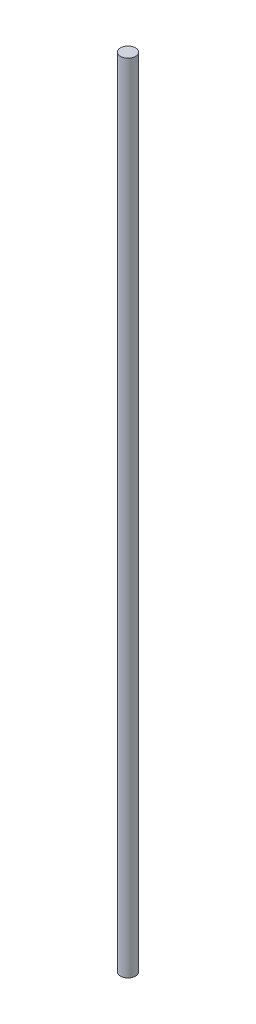
from build123d import *

# Parameters (mm, degrees)
SKETCH1_R           = 3
BOSS_EXTRUDE1_DEPTH = 320


with BuildPart() as part:
    # Sketch1 → Boss-Extrude1 (new body)
    with BuildSketch(Plane(origin=(0, 0, 0), x_dir=(1, 0, 0), z_dir=(0, 1, 0))):
        Circle(SKETCH1_R)
    extrude(amount=BOSS_EXTRUDE1_DEPTH)


solid = part.part
